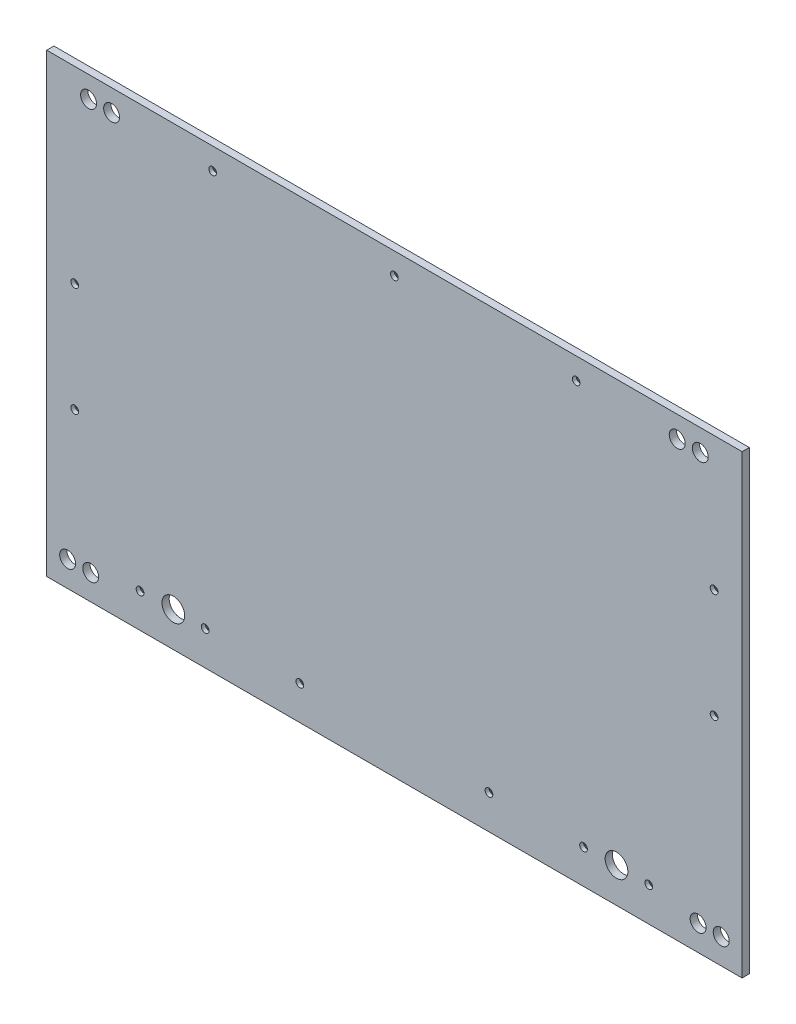
from build123d import *

# Parameters (mm, degrees)
SKETCH1_W                                       = 306.05
SKETCH1_H                                       = 197.425
BOSS_EXTRUDE1_DEPTH                             = 3.175
SKETCH2_R                                       = 5
CUT_EXTRUDE1_DEPTH                              = 183.128770122
SKETCH3_R                                       = 3.5
CUT_EXTRUDE2_DEPTH                              = 183.128770122
CSK_FOR_M3_FLAT_HEAD_MACHINE_SCREW1_D           = 3.4
CSK_FOR_M3_FLAT_HEAD_MACHINE_SCREW1_CSINK_D     = 6.3
CSK_FOR_M3_FLAT_HEAD_MACHINE_SCREW1_CSINK_ANGLE = 90
CSK_FOR_M3_FLAT_HEAD_MACHINE_SCREW2_D           = 3.4
CSK_FOR_M3_FLAT_HEAD_MACHINE_SCREW2_CSINK_D     = 6.3
CSK_FOR_M3_FLAT_HEAD_MACHINE_SCREW2_CSINK_ANGLE = 90
SKETCH9_W                                       = 306.05
SKETCH9_H                                       = 3.175
BOSS_EXTRUDE2_DEPTH                             = 3.175


with BuildPart() as part:
    # Sketch1 → Boss-Extrude1 (new body)
    with BuildSketch(Plane.XY):
        Rectangle(SKETCH1_W, SKETCH1_H)
    extrude(amount=BOSS_EXTRUDE1_DEPTH)

    # Sketch2 → Cut-Extrude1 (cut, through all)
    with BuildSketch(Plane(origin=(0, 0, 0), x_dir=(-1, 0, 0), z_dir=(0, 0, -1))):
        with Locations((-97.75, -83.334)):
            Circle(SKETCH2_R)
        with Locations((97.288, -83.334)):
            Circle(SKETCH2_R)
    extrude(amount=-CUT_EXTRUDE1_DEPTH, mode=Mode.SUBTRACT)

    # Sketch3 → Cut-Extrude2 (cut, through all)
    with BuildSketch(Plane(origin=(0, 0, 0), x_dir=(-1, 0, 0), z_dir=(0, 0, -1))):
        with Locations((-124.450000066, 92.3625)):
            Circle(SKETCH3_R)
        with Locations((-134.610000066, 92.3625)):
            Circle(SKETCH3_R)
        with Locations((-133.657500066, -87.5375001)):
            Circle(SKETCH3_R)
        with Locations((-143.817500066, -87.5375001)):
            Circle(SKETCH3_R)
    cut_extrude2 = extrude(amount=-CUT_EXTRUDE2_DEPTH, mode=Mode.SUBTRACT)

    # CSK for M3 Flat Head Machine Screw1 (through all)
    with Locations(Plane(origin=(0, 0, 0), x_dir=(-1, 0, 0), z_dir=(0, 0, -1))):
        with Locations((-111.94, -83.7125), (-83.25, -83.7125), (80, 92.3625), (0, 92.3625)):
            csk_for_m3_flat_head_machine_screw1 = CounterSinkHole(CSK_FOR_M3_FLAT_HEAD_MACHINE_SCREW1_D / 2, CSK_FOR_M3_FLAT_HEAD_MACHINE_SCREW1_CSINK_D / 2, counter_sink_angle=CSK_FOR_M3_FLAT_HEAD_MACHINE_SCREW1_CSINK_ANGLE)

    # Mirror2: Cut-Extrude2, CSK for M3 Flat Head Machine Screw1 across plane
    add(cut_extrude2.mirror(Plane(origin=(0, 0, 0), x_dir=(0, 0, 1), z_dir=(1, 0, 0))), mode=Mode.SUBTRACT)
    add(csk_for_m3_flat_head_machine_screw1.mirror(Plane(origin=(0, 0, 0), x_dir=(0, 0, 1), z_dir=(1, 0, 0))), mode=Mode.SUBTRACT)

    # CSK for M3 Flat Head Machine Screw2 (through all)
    with Locations(Plane(origin=(0, 0, 0), x_dir=(-1, 0, 0), z_dir=(0, 0, -1))):
        with Locations((-140.687500033, 43.0625), (-140.687500033, -4.9375), (-41.625, -83.7125), (41.625, -83.7125), (140.687500033, -28.9375), (140.687500033, 19.0625)):
            CounterSinkHole(CSK_FOR_M3_FLAT_HEAD_MACHINE_SCREW2_D / 2, CSK_FOR_M3_FLAT_HEAD_MACHINE_SCREW2_CSINK_D / 2, counter_sink_angle=CSK_FOR_M3_FLAT_HEAD_MACHINE_SCREW2_CSINK_ANGLE)

    # Sketch9 → Boss-Extrude2 (add)
    with BuildSketch(Plane(origin=(0, 98.7125, 0), x_dir=(1, 0, 0), z_dir=(0, 1, 0))):
        with Locations((0, -1.5875)):
            Rectangle(SKETCH9_W, SKETCH9_H)
    extrude(amount=BOSS_EXTRUDE2_DEPTH)


solid = part.part
